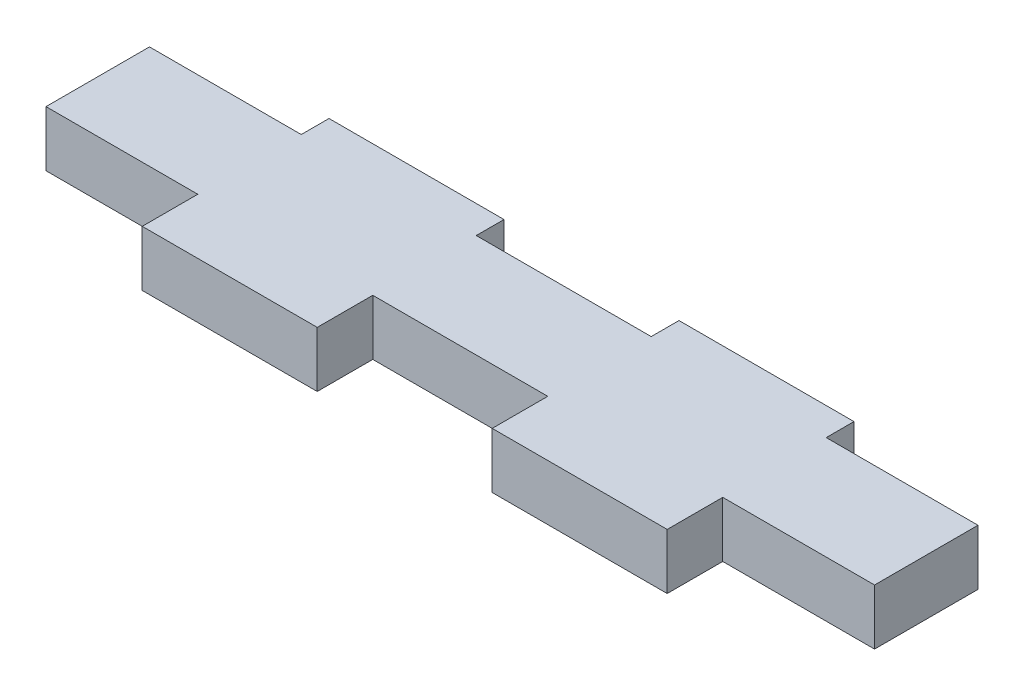
from build123d import *

# Parameters (mm, degrees)
SKETCH1_W           = 47.35
SKETCH1_H           = 10.675
BOSS_EXTRUDE1_DEPTH = 3.175
SKETCH2_W           = 8.675
SKETCH2_H           = 3.175
SKETCH2_W_2         = 10
SKETCH2_H_2         = 1.5875
CUT_EXTRUDE1_DEPTH  = 49.642149932


with BuildPart() as part:
    # Sketch1 → Boss-Extrude1 (new body)
    with BuildSketch(Plane(origin=(0, 0, 0), x_dir=(1, 0, 0), z_dir=(0, 1, 0))):
        with Locations((23.675, 5.3375)):
            Rectangle(SKETCH1_W, SKETCH1_H)
    extrude(amount=BOSS_EXTRUDE1_DEPTH)

    # Sketch2 → Cut-Extrude1 (cut, through all)
    with BuildSketch(Plane.XZ):
        with Locations((43.0125, -1.5875)):
            Rectangle(SKETCH2_W, SKETCH2_H)
        with Locations((23.675, -1.5875)):
            Rectangle(SKETCH2_W_2, SKETCH2_H)
        with Locations((4.3375, -1.5875)):
            Rectangle(SKETCH2_W, SKETCH2_H)
        with Locations((43.0125, -9.88125)):
            Rectangle(SKETCH2_W, SKETCH2_H_2)
        with Locations((23.675, -9.88125)):
            Rectangle(SKETCH2_W_2, SKETCH2_H_2)
        with Locations((4.3375, -9.88125)):
            Rectangle(SKETCH2_W, SKETCH2_H_2)
    extrude(amount=-CUT_EXTRUDE1_DEPTH, mode=Mode.SUBTRACT)


solid = part.part
